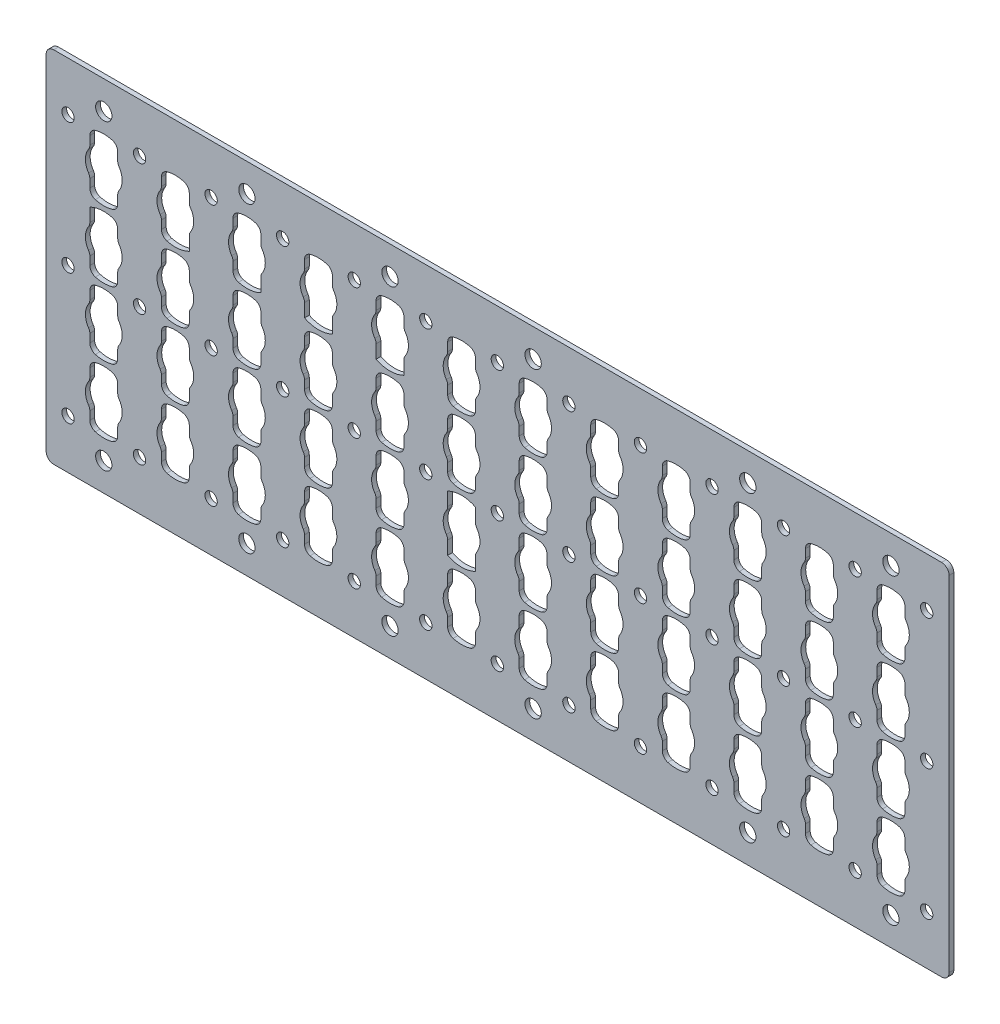
from build123d import *

# Parameters (mm, degrees)
SKETCH2_R           = 10.499946832
SKETCH2_R_2         = 2.752000084
BOSS_EXTRUDE1_DEPTH = 1.6
SKETCH7_R           = 1.2319
BOSS_EXTRUDE4_DEPTH = 1.6
FILLET1_R           = 2.54
SKETCH3_R           = 2.0828
CUT_EXTRUDE1_DEPTH  = 301.291907907
FILLET2_R           = 2.54


with BuildPart() as part:
    # Sketch2 → Boss-Extrude1 (new body)
    with BuildSketch(Plane.XY):
        Polygon((-19.430000002, 91.526), (-19.430000002, -23.708), (-19.430000002, -26.629), (285.048126016, -26.629), (285.048126016, -23.708), (285.048126016, 91.526), (285.048126016, 94.447), (-19.430000002, 94.447), align=None)
        Circle(SKETCH2_R, mode=Mode.SUBTRACT)
        with Locations((24.13, 0)):
            Circle(SKETCH2_R, mode=Mode.SUBTRACT)
        with Locations((48.26, 0)):
            Circle(SKETCH2_R, mode=Mode.SUBTRACT)
        with Locations((72.39, 0)):
            Circle(SKETCH2_R, mode=Mode.SUBTRACT)
        with Locations((24.13, 22.606)):
            Circle(SKETCH2_R, mode=Mode.SUBTRACT)
        with Locations((48.26, 22.606)):
            Circle(SKETCH2_R, mode=Mode.SUBTRACT)
        with Locations((72.39, 22.606)):
            Circle(SKETCH2_R, mode=Mode.SUBTRACT)
        with Locations((24.13, 45.212)):
            Circle(SKETCH2_R, mode=Mode.SUBTRACT)
        with Locations((48.26, 45.212)):
            Circle(SKETCH2_R, mode=Mode.SUBTRACT)
        with Locations((72.39, 45.212)):
            Circle(SKETCH2_R, mode=Mode.SUBTRACT)
        with Locations((24.13, 67.818)):
            Circle(SKETCH2_R, mode=Mode.SUBTRACT)
        with Locations((48.26, 67.818)):
            Circle(SKETCH2_R, mode=Mode.SUBTRACT)
        with Locations((72.39, 67.818)):
            Circle(SKETCH2_R, mode=Mode.SUBTRACT)
        with Locations((0, 22.606)):
            Circle(SKETCH2_R, mode=Mode.SUBTRACT)
        with Locations((0, 45.212)):
            Circle(SKETCH2_R, mode=Mode.SUBTRACT)
        with Locations((0, 67.818)):
            Circle(SKETCH2_R, mode=Mode.SUBTRACT)
        with Locations((96.52, 0)):
            Circle(SKETCH2_R, mode=Mode.SUBTRACT)
        with Locations((120.65, 0)):
            Circle(SKETCH2_R, mode=Mode.SUBTRACT)
        with Locations((144.78, 0)):
            Circle(SKETCH2_R, mode=Mode.SUBTRACT)
        with Locations((168.91, 0)):
            Circle(SKETCH2_R, mode=Mode.SUBTRACT)
        with Locations((193.04, 0)):
            Circle(SKETCH2_R, mode=Mode.SUBTRACT)
        with Locations((217.17, 0)):
            Circle(SKETCH2_R, mode=Mode.SUBTRACT)
        with Locations((241.3, 0)):
            Circle(SKETCH2_R, mode=Mode.SUBTRACT)
        with Locations((265.43, 0)):
            Circle(SKETCH2_R, mode=Mode.SUBTRACT)
        with Locations((96.52, 22.606)):
            Circle(SKETCH2_R, mode=Mode.SUBTRACT)
        with Locations((120.65, 22.606)):
            Circle(SKETCH2_R, mode=Mode.SUBTRACT)
        with Locations((144.78, 22.606)):
            Circle(SKETCH2_R, mode=Mode.SUBTRACT)
        with Locations((168.91, 22.606)):
            Circle(SKETCH2_R, mode=Mode.SUBTRACT)
        with Locations((193.04, 22.606)):
            Circle(SKETCH2_R, mode=Mode.SUBTRACT)
        with Locations((217.17, 22.606)):
            Circle(SKETCH2_R, mode=Mode.SUBTRACT)
        with Locations((241.3, 22.606)):
            Circle(SKETCH2_R, mode=Mode.SUBTRACT)
        with Locations((265.43, 22.606)):
            Circle(SKETCH2_R, mode=Mode.SUBTRACT)
        with Locations((96.52, 45.212)):
            Circle(SKETCH2_R, mode=Mode.SUBTRACT)
        with Locations((120.65, 45.212)):
            Circle(SKETCH2_R, mode=Mode.SUBTRACT)
        with Locations((144.78, 45.212)):
            Circle(SKETCH2_R, mode=Mode.SUBTRACT)
        with Locations((168.91, 45.212)):
            Circle(SKETCH2_R, mode=Mode.SUBTRACT)
        with Locations((193.04, 45.212)):
            Circle(SKETCH2_R, mode=Mode.SUBTRACT)
        with Locations((217.17, 45.212)):
            Circle(SKETCH2_R, mode=Mode.SUBTRACT)
        with Locations((241.3, 45.212)):
            Circle(SKETCH2_R, mode=Mode.SUBTRACT)
        with Locations((265.43, 45.212)):
            Circle(SKETCH2_R, mode=Mode.SUBTRACT)
        with Locations((96.52, 67.818)):
            Circle(SKETCH2_R, mode=Mode.SUBTRACT)
        with Locations((120.65, 67.818)):
            Circle(SKETCH2_R, mode=Mode.SUBTRACT)
        with Locations((144.78, 67.818)):
            Circle(SKETCH2_R, mode=Mode.SUBTRACT)
        with Locations((168.91, 67.818)):
            Circle(SKETCH2_R, mode=Mode.SUBTRACT)
        with Locations((193.04, 67.818)):
            Circle(SKETCH2_R, mode=Mode.SUBTRACT)
        with Locations((217.17, 67.818)):
            Circle(SKETCH2_R, mode=Mode.SUBTRACT)
        with Locations((241.3, 67.818)):
            Circle(SKETCH2_R, mode=Mode.SUBTRACT)
        with Locations((265.43, 67.818)):
            Circle(SKETCH2_R, mode=Mode.SUBTRACT)
        with Locations((0, 84.921973416)):
            Circle(SKETCH2_R_2, mode=Mode.SUBTRACT)
        with Locations((48.26, 84.921973416)):
            Circle(SKETCH2_R_2, mode=Mode.SUBTRACT)
        with Locations((96.52, 84.921973416)):
            Circle(SKETCH2_R_2, mode=Mode.SUBTRACT)
        with Locations((144.78, 84.921973416)):
            Circle(SKETCH2_R_2, mode=Mode.SUBTRACT)
        with Locations((217.17, 84.921973416)):
            Circle(SKETCH2_R_2, mode=Mode.SUBTRACT)
        with Locations((265.43, 84.921973416)):
            Circle(SKETCH2_R_2, mode=Mode.SUBTRACT)
        with Locations(Location((265.43, -17.103973416, 0), (0, 0, 180))):
            Circle(SKETCH2_R_2, mode=Mode.SUBTRACT)
        with Locations(Location((217.17, -17.103973416, 0), (0, 0, 180))):
            Circle(SKETCH2_R_2, mode=Mode.SUBTRACT)
        with Locations(Location((144.78, -17.103973416, 0), (0, 0, 180))):
            Circle(SKETCH2_R_2, mode=Mode.SUBTRACT)
        with Locations(Location((96.52, -17.103973416, 0), (0, 0, 180))):
            Circle(SKETCH2_R_2, mode=Mode.SUBTRACT)
        with Locations(Location((48.26, -17.103973416, 0), (0, 0, 180))):
            Circle(SKETCH2_R_2, mode=Mode.SUBTRACT)
        with Locations(Location((0, -17.103973416, 0), (0, 0, 180))):
            Circle(SKETCH2_R_2, mode=Mode.SUBTRACT)
    extrude(amount=BOSS_EXTRUDE1_DEPTH)

    # Sketch7 → Boss-Extrude4 (add, through all)
    # profile 1 of 13: a face of its own
    with BuildSketch(Plane.XY.offset(1.6)):
        with BuildLine():
            Line((19.430000002, 62.922315409), (19.430000002, 50.107684591))
            ThreePointArc((19.430000002, 50.107684591), (19.318582458, 49.363650145), (18.994104525, 48.684890102))
            ThreePointArc((18.994104525, 48.684890102), (17.930130002, 45.212), (18.994104525, 41.739109898))
            ThreePointArc((18.994104525, 41.739109898), (19.318582458, 41.060349855), (19.430000002, 40.316315409))
            Line((19.430000002, 40.316315409), (19.430000002, 27.501684591))
            ThreePointArc((19.430000002, 27.501684591), (19.318582458, 26.757650145), (18.994104525, 26.078890102))
            ThreePointArc((18.994104525, 26.078890102), (17.930130002, 22.606), (18.994104525, 19.133109898))
            ThreePointArc((18.994104525, 19.133109898), (19.318582458, 18.454349855), (19.430000002, 17.710315409))
            Line((19.430000002, 17.710315409), (19.430000002, 4.895684591))
            ThreePointArc((19.430000002, 4.895684591), (19.318582458, 4.151650145), (18.994104525, 3.472890102))
            ThreePointArc((18.994104525, 3.472890102), (17.930130002, 0), (18.994104525, -3.472890102))
            ThreePointArc((18.994104525, -3.472890102), (19.318582458, -4.151650145), (19.430000002, -4.895684591))
            Line((19.430000002, -4.895684591), (19.430000002, -10.5))
            Line((19.430000002, -10.5), (4.699999998, -10.5))
            Line((4.699999998, -10.5), (4.699999998, -4.895684591))
            ThreePointArc((4.699999998, -4.895684591), (4.811417542, -4.151650145), (5.135895475, -3.472890102))
            ThreePointArc((5.135895475, -3.472890102), (6.199869998, 0), (5.135895475, 3.472890102))
            ThreePointArc((5.135895475, 3.472890102), (4.811417542, 4.151650145), (4.699999998, 4.895684591))
            Line((4.699999998, 4.895684591), (4.699999998, 17.710315409))
            ThreePointArc((4.699999998, 17.710315409), (4.811417542, 18.454349855), (5.135895475, 19.133109898))
            ThreePointArc((5.135895475, 19.133109898), (6.199869998, 22.606), (5.135895475, 26.078890102))
            ThreePointArc((5.135895475, 26.078890102), (4.811417542, 26.757650145), (4.699999998, 27.501684591))
            Line((4.699999998, 27.501684591), (4.699999998, 40.316315409))
            ThreePointArc((4.699999998, 40.316315409), (4.811417542, 41.060349855), (5.135895475, 41.739109898))
            ThreePointArc((5.135895475, 41.739109898), (6.199869998, 45.212), (5.135895475, 48.684890102))
            ThreePointArc((5.135895475, 48.684890102), (4.811417542, 49.363650145), (4.699999998, 50.107684591))
            Line((4.699999998, 50.107684591), (4.699999998, 62.922315409))
            ThreePointArc((4.699999998, 62.922315409), (4.811417542, 63.666349855), (5.135895475, 64.345109898))
            ThreePointArc((5.135895475, 64.345109898), (6.199869998, 67.818), (5.135895475, 71.290890102))
            ThreePointArc((5.135895475, 71.290890102), (4.811417542, 71.969650145), (4.699999998, 72.713684591))
            Line((4.699999998, 72.713684591), (4.699999998, 78.318))
            Line((4.699999998, 78.318), (19.430000002, 78.318))
            Line((19.430000002, 78.318), (19.430000002, 72.713684591))
            ThreePointArc((19.430000002, 72.713684591), (19.318582458, 71.969650145), (18.994104525, 71.290890102))
            ThreePointArc((18.994104525, 71.290890102), (17.930130002, 67.818), (18.994104525, 64.345109898))
            ThreePointArc((18.994104525, 64.345109898), (19.318582458, 63.666349855), (19.430000002, 62.922315409))
        make_face()
        with Locations((12.065, 75.355240112)):
            Circle(SKETCH7_R, mode=Mode.SUBTRACT)
        with Locations((12.065, -7.537240112)):
            Circle(SKETCH7_R, mode=Mode.SUBTRACT)
    # profile 2 of 13: a face of its own
    with BuildSketch(Plane.XY.offset(1.6)):
        with BuildLine():
            Line((28.829999998, 17.710315409), (28.829999998, 4.895684591))
            ThreePointArc((28.829999998, 4.895684591), (28.941417542, 4.151650145), (29.265895475, 3.472890102))
            ThreePointArc((29.265895475, 3.472890102), (30.329869998, 0), (29.265895475, -3.472890102))
            ThreePointArc((29.265895475, -3.472890102), (28.941417542, -4.151650145), (28.829999998, -4.895684591))
            Line((28.829999998, -4.895684591), (28.829999998, -10.5))
            Line((28.829999998, -10.5), (43.560000002, -10.5))
            Line((43.560000002, -10.5), (43.560000002, -4.895684591))
            ThreePointArc((43.560000002, -4.895684591), (43.448582458, -4.151650145), (43.124104525, -3.472890102))
            ThreePointArc((43.124104525, -3.472890102), (42.060130002, 0), (43.124104525, 3.472890102))
            ThreePointArc((43.124104525, 3.472890102), (43.448582458, 4.151650145), (43.560000002, 4.895684591))
            Line((43.560000002, 4.895684591), (43.560000002, 17.710315409))
            ThreePointArc((43.560000002, 17.710315409), (43.448582458, 18.454349855), (43.124104525, 19.133109898))
            ThreePointArc((43.124104525, 19.133109898), (42.060130002, 22.606), (43.124104525, 26.078890102))
            ThreePointArc((43.124104525, 26.078890102), (43.448582458, 26.757650145), (43.560000002, 27.501684591))
            Line((43.560000002, 27.501684591), (43.560000002, 40.316315409))
            ThreePointArc((43.560000002, 40.316315409), (43.448582458, 41.060349855), (43.124104525, 41.739109898))
            ThreePointArc((43.124104525, 41.739109898), (42.060130002, 45.212), (43.124104525, 48.684890102))
            ThreePointArc((43.124104525, 48.684890102), (43.448582458, 49.363650145), (43.560000002, 50.107684591))
            Line((43.560000002, 50.107684591), (43.560000002, 62.922315409))
            ThreePointArc((43.560000002, 62.922315409), (43.448582458, 63.666349855), (43.124104525, 64.345109898))
            ThreePointArc((43.124104525, 64.345109898), (42.060130002, 67.818), (43.124104525, 71.290890102))
            ThreePointArc((43.124104525, 71.290890102), (43.448582458, 71.969650145), (43.560000002, 72.713684591))
            Line((43.560000002, 72.713684591), (43.560000002, 78.318))
            Line((43.560000002, 78.318), (28.829999998, 78.318))
            Line((28.829999998, 78.318), (28.829999998, 72.713684591))
            ThreePointArc((28.829999998, 72.713684591), (28.941417542, 71.969650145), (29.265895475, 71.290890102))
            ThreePointArc((29.265895475, 71.290890102), (30.329869998, 67.818), (29.265895475, 64.345109898))
            ThreePointArc((29.265895475, 64.345109898), (28.941417542, 63.666349855), (28.829999998, 62.922315409))
            Line((28.829999998, 62.922315409), (28.829999998, 50.107684591))
            ThreePointArc((28.829999998, 50.107684591), (28.941417542, 49.363650145), (29.265895475, 48.684890102))
            ThreePointArc((29.265895475, 48.684890102), (30.329869998, 45.212), (29.265895475, 41.739109898))
            ThreePointArc((29.265895475, 41.739109898), (28.941417542, 41.060349855), (28.829999998, 40.316315409))
            Line((28.829999998, 40.316315409), (28.829999998, 27.501684591))
            ThreePointArc((28.829999998, 27.501684591), (28.941417542, 26.757650145), (29.265895475, 26.078890102))
            ThreePointArc((29.265895475, 26.078890102), (30.329869998, 22.606), (29.265895475, 19.133109898))
            ThreePointArc((29.265895475, 19.133109898), (28.941417542, 18.454349855), (28.829999998, 17.710315409))
        make_face()
    # profile 3 of 13: a face of its own
    with BuildSketch(Plane.XY.offset(1.6)):
        with BuildLine():
            Line((52.959999998, 17.710315409), (52.959999998, 4.895684591))
            ThreePointArc((52.959999998, 4.895684591), (53.071417542, 4.151650145), (53.395895475, 3.472890102))
            ThreePointArc((53.395895475, 3.472890102), (54.459869998, 0), (53.395895475, -3.472890102))
            ThreePointArc((53.395895475, -3.472890102), (53.071417542, -4.151650145), (52.959999998, -4.895684591))
            Line((52.959999998, -4.895684591), (52.959999998, -10.5))
            Line((52.959999998, -10.5), (67.690000002, -10.5))
            Line((67.690000002, -10.5), (67.690000002, -4.895684591))
            ThreePointArc((67.690000002, -4.895684591), (67.578582458, -4.151650145), (67.254104525, -3.472890102))
            ThreePointArc((67.254104525, -3.472890102), (66.190130002, 0), (67.254104525, 3.472890102))
            ThreePointArc((67.254104525, 3.472890102), (67.578582458, 4.151650145), (67.690000002, 4.895684591))
            Line((67.690000002, 4.895684591), (67.690000002, 17.710315409))
            ThreePointArc((67.690000002, 17.710315409), (67.578582458, 18.454349855), (67.254104525, 19.133109898))
            ThreePointArc((67.254104525, 19.133109898), (66.190130002, 22.606), (67.254104525, 26.078890102))
            ThreePointArc((67.254104525, 26.078890102), (67.578582458, 26.757650145), (67.690000002, 27.501684591))
            Line((67.690000002, 27.501684591), (67.690000002, 40.316315409))
            ThreePointArc((67.690000002, 40.316315409), (67.578582458, 41.060349855), (67.254104525, 41.739109898))
            ThreePointArc((67.254104525, 41.739109898), (66.190130002, 45.212), (67.254104525, 48.684890102))
            ThreePointArc((67.254104525, 48.684890102), (67.578582458, 49.363650145), (67.690000002, 50.107684591))
            Line((67.690000002, 50.107684591), (67.690000002, 62.922315409))
            ThreePointArc((67.690000002, 62.922315409), (67.578582458, 63.666349855), (67.254104525, 64.345109898))
            ThreePointArc((67.254104525, 64.345109898), (66.190130002, 67.818), (67.254104525, 71.290890102))
            ThreePointArc((67.254104525, 71.290890102), (67.578582458, 71.969650145), (67.690000002, 72.713684591))
            Line((67.690000002, 72.713684591), (67.690000002, 78.318))
            Line((67.690000002, 78.318), (52.959999998, 78.318))
            Line((52.959999998, 78.318), (52.959999998, 72.713684591))
            ThreePointArc((52.959999998, 72.713684591), (53.071417542, 71.969650145), (53.395895475, 71.290890102))
            ThreePointArc((53.395895475, 71.290890102), (54.459869998, 67.818), (53.395895475, 64.345109898))
            ThreePointArc((53.395895475, 64.345109898), (53.071417542, 63.666349855), (52.959999998, 62.922315409))
            Line((52.959999998, 62.922315409), (52.959999998, 50.107684591))
            ThreePointArc((52.959999998, 50.107684591), (53.071417542, 49.363650145), (53.395895475, 48.684890102))
            ThreePointArc((53.395895475, 48.684890102), (54.459869998, 45.212), (53.395895475, 41.739109898))
            ThreePointArc((53.395895475, 41.739109898), (53.071417542, 41.060349855), (52.959999998, 40.316315409))
            Line((52.959999998, 40.316315409), (52.959999998, 27.501684591))
            ThreePointArc((52.959999998, 27.501684591), (53.071417542, 26.757650145), (53.395895475, 26.078890102))
            ThreePointArc((53.395895475, 26.078890102), (54.459869998, 22.606), (53.395895475, 19.133109898))
            ThreePointArc((53.395895475, 19.133109898), (53.071417542, 18.454349855), (52.959999998, 17.710315409))
        make_face()
    # profile 4 of 13: a face of its own
    with BuildSketch(Plane.XY.offset(1.6)):
        with BuildLine():
            Line((77.089999998, 17.710315409), (77.089999998, 4.895684591))
            ThreePointArc((77.089999998, 4.895684591), (77.201417542, 4.151650145), (77.525895475, 3.472890102))
            ThreePointArc((77.525895475, 3.472890102), (78.589869998, 0), (77.525895475, -3.472890102))
            ThreePointArc((77.525895475, -3.472890102), (77.201417542, -4.151650145), (77.089999998, -4.895684591))
            Line((77.089999998, -4.895684591), (77.089999998, -10.5))
            Line((77.089999998, -10.5), (91.820000002, -10.5))
            Line((91.820000002, -10.5), (91.820000002, -4.895684591))
            ThreePointArc((91.820000002, -4.895684591), (91.708582458, -4.151650145), (91.384104525, -3.472890102))
            ThreePointArc((91.384104525, -3.472890102), (90.320130002, 0), (91.384104525, 3.472890102))
            ThreePointArc((91.384104525, 3.472890102), (91.708582458, 4.151650145), (91.820000002, 4.895684591))
            Line((91.820000002, 4.895684591), (91.820000002, 17.710315409))
            ThreePointArc((91.820000002, 17.710315409), (91.708582458, 18.454349855), (91.384104525, 19.133109898))
            ThreePointArc((91.384104525, 19.133109898), (90.320130002, 22.606), (91.384104525, 26.078890102))
            ThreePointArc((91.384104525, 26.078890102), (91.708582458, 26.757650145), (91.820000002, 27.501684591))
            Line((91.820000002, 27.501684591), (91.820000002, 40.316315409))
            ThreePointArc((91.820000002, 40.316315409), (91.708582458, 41.060349855), (91.384104525, 41.739109898))
            ThreePointArc((91.384104525, 41.739109898), (90.320130002, 45.212), (91.384104525, 48.684890102))
            ThreePointArc((91.384104525, 48.684890102), (91.708582458, 49.363650145), (91.820000002, 50.107684591))
            Line((91.820000002, 50.107684591), (91.820000002, 62.922315409))
            ThreePointArc((91.820000002, 62.922315409), (91.708582458, 63.666349855), (91.384104525, 64.345109898))
            ThreePointArc((91.384104525, 64.345109898), (90.320130002, 67.818), (91.384104525, 71.290890102))
            ThreePointArc((91.384104525, 71.290890102), (91.708582458, 71.969650145), (91.820000002, 72.713684591))
            Line((91.820000002, 72.713684591), (91.820000002, 78.318))
            Line((91.820000002, 78.318), (77.089999998, 78.318))
            Line((77.089999998, 78.318), (77.089999998, 72.713684591))
            ThreePointArc((77.089999998, 72.713684591), (77.201417542, 71.969650145), (77.525895475, 71.290890102))
            ThreePointArc((77.525895475, 71.290890102), (78.589869998, 67.818), (77.525895475, 64.345109898))
            ThreePointArc((77.525895475, 64.345109898), (77.201417542, 63.666349855), (77.089999998, 62.922315409))
            Line((77.089999998, 62.922315409), (77.089999998, 50.107684591))
            ThreePointArc((77.089999998, 50.107684591), (77.201417542, 49.363650145), (77.525895475, 48.684890102))
            ThreePointArc((77.525895475, 48.684890102), (78.589869998, 45.212), (77.525895475, 41.739109898))
            ThreePointArc((77.525895475, 41.739109898), (77.201417542, 41.060349855), (77.089999998, 40.316315409))
            Line((77.089999998, 40.316315409), (77.089999998, 27.501684591))
            ThreePointArc((77.089999998, 27.501684591), (77.201417542, 26.757650145), (77.525895475, 26.078890102))
            ThreePointArc((77.525895475, 26.078890102), (78.589869998, 22.606), (77.525895475, 19.133109898))
            ThreePointArc((77.525895475, 19.133109898), (77.201417542, 18.454349855), (77.089999998, 17.710315409))
        make_face()
    # profile 5 of 13: a face of its own
    with BuildSketch(Plane.XY.offset(1.6)):
        with BuildLine():
            Line((101.219999998, 17.710315409), (101.219999998, 4.895684591))
            ThreePointArc((101.219999998, 4.895684591), (101.331417542, 4.151650145), (101.655895475, 3.472890102))
            ThreePointArc((101.655895475, 3.472890102), (102.719869998, 0), (101.655895475, -3.472890102))
            ThreePointArc((101.655895475, -3.472890102), (101.331417542, -4.151650145), (101.219999998, -4.895684591))
            Line((101.219999998, -4.895684591), (101.219999998, -10.5))
            Line((101.219999998, -10.5), (115.950000002, -10.5))
            Line((115.950000002, -10.5), (115.950000002, -4.895684591))
            ThreePointArc((115.950000002, -4.895684591), (115.838582458, -4.151650145), (115.514104525, -3.472890102))
            ThreePointArc((115.514104525, -3.472890102), (114.450130002, 0), (115.514104525, 3.472890102))
            ThreePointArc((115.514104525, 3.472890102), (115.838582458, 4.151650145), (115.950000002, 4.895684591))
            Line((115.950000002, 4.895684591), (115.950000002, 17.710315409))
            ThreePointArc((115.950000002, 17.710315409), (115.838582458, 18.454349855), (115.514104525, 19.133109898))
            ThreePointArc((115.514104525, 19.133109898), (114.450130002, 22.606), (115.514104525, 26.078890102))
            ThreePointArc((115.514104525, 26.078890102), (115.838582458, 26.757650145), (115.950000002, 27.501684591))
            Line((115.950000002, 27.501684591), (115.950000002, 40.316315409))
            ThreePointArc((115.950000002, 40.316315409), (115.838582458, 41.060349855), (115.514104525, 41.739109898))
            ThreePointArc((115.514104525, 41.739109898), (114.450130002, 45.212), (115.514104525, 48.684890102))
            ThreePointArc((115.514104525, 48.684890102), (115.838582458, 49.363650145), (115.950000002, 50.107684591))
            Line((115.950000002, 50.107684591), (115.950000002, 62.922315409))
            ThreePointArc((115.950000002, 62.922315409), (115.838582458, 63.666349855), (115.514104525, 64.345109898))
            ThreePointArc((115.514104525, 64.345109898), (114.450130002, 67.818), (115.514104525, 71.290890102))
            ThreePointArc((115.514104525, 71.290890102), (115.838582458, 71.969650145), (115.950000002, 72.713684591))
            Line((115.950000002, 72.713684591), (115.950000002, 78.318))
            Line((115.950000002, 78.318), (101.219999998, 78.318))
            Line((101.219999998, 78.318), (101.219999998, 72.713684591))
            ThreePointArc((101.219999998, 72.713684591), (101.331417542, 71.969650145), (101.655895475, 71.290890102))
            ThreePointArc((101.655895475, 71.290890102), (102.719869998, 67.818), (101.655895475, 64.345109898))
            ThreePointArc((101.655895475, 64.345109898), (101.331417542, 63.666349855), (101.219999998, 62.922315409))
            Line((101.219999998, 62.922315409), (101.219999998, 50.107684591))
            ThreePointArc((101.219999998, 50.107684591), (101.331417542, 49.363650145), (101.655895475, 48.684890102))
            ThreePointArc((101.655895475, 48.684890102), (102.719869998, 45.212), (101.655895475, 41.739109898))
            ThreePointArc((101.655895475, 41.739109898), (101.331417542, 41.060349855), (101.219999998, 40.316315409))
            Line((101.219999998, 40.316315409), (101.219999998, 27.501684591))
            ThreePointArc((101.219999998, 27.501684591), (101.331417542, 26.757650145), (101.655895475, 26.078890102))
            ThreePointArc((101.655895475, 26.078890102), (102.719869998, 22.606), (101.655895475, 19.133109898))
            ThreePointArc((101.655895475, 19.133109898), (101.331417542, 18.454349855), (101.219999998, 17.710315409))
        make_face()
    # profile 6 of 13: a face of its own
    with BuildSketch(Plane.XY.offset(1.6)):
        with BuildLine():
            Line((125.349999998, 17.710315409), (125.349999998, 4.895684591))
            ThreePointArc((125.349999998, 4.895684591), (125.461417542, 4.151650145), (125.785895475, 3.472890102))
            ThreePointArc((125.785895475, 3.472890102), (126.849869998, 0), (125.785895475, -3.472890102))
            ThreePointArc((125.785895475, -3.472890102), (125.461417542, -4.151650145), (125.349999998, -4.895684591))
            Line((125.349999998, -4.895684591), (125.349999998, -10.5))
            Line((125.349999998, -10.5), (140.080000002, -10.5))
            Line((140.080000002, -10.5), (140.080000002, -4.895684591))
            ThreePointArc((140.080000002, -4.895684591), (139.968582458, -4.151650145), (139.644104525, -3.472890102))
            ThreePointArc((139.644104525, -3.472890102), (138.580130002, 0), (139.644104525, 3.472890102))
            ThreePointArc((139.644104525, 3.472890102), (139.968582458, 4.151650145), (140.080000002, 4.895684591))
            Line((140.080000002, 4.895684591), (140.080000002, 17.710315409))
            ThreePointArc((140.080000002, 17.710315409), (139.968582458, 18.454349855), (139.644104525, 19.133109898))
            ThreePointArc((139.644104525, 19.133109898), (138.580130002, 22.606), (139.644104525, 26.078890102))
            ThreePointArc((139.644104525, 26.078890102), (139.968582458, 26.757650145), (140.080000002, 27.501684591))
            Line((140.080000002, 27.501684591), (140.080000002, 40.316315409))
            ThreePointArc((140.080000002, 40.316315409), (139.968582458, 41.060349855), (139.644104525, 41.739109898))
            ThreePointArc((139.644104525, 41.739109898), (138.580130002, 45.212), (139.644104525, 48.684890102))
            ThreePointArc((139.644104525, 48.684890102), (139.968582458, 49.363650145), (140.080000002, 50.107684591))
            Line((140.080000002, 50.107684591), (140.080000002, 62.922315409))
            ThreePointArc((140.080000002, 62.922315409), (139.968582458, 63.666349855), (139.644104525, 64.345109898))
            ThreePointArc((139.644104525, 64.345109898), (138.580130002, 67.818), (139.644104525, 71.290890102))
            ThreePointArc((139.644104525, 71.290890102), (139.968582458, 71.969650145), (140.080000002, 72.713684591))
            Line((140.080000002, 72.713684591), (140.080000002, 78.318))
            Line((140.080000002, 78.318), (125.349999998, 78.318))
            Line((125.349999998, 78.318), (125.349999998, 72.713684591))
            ThreePointArc((125.349999998, 72.713684591), (125.461417542, 71.969650145), (125.785895475, 71.290890102))
            ThreePointArc((125.785895475, 71.290890102), (126.849869998, 67.818), (125.785895475, 64.345109898))
            ThreePointArc((125.785895475, 64.345109898), (125.461417542, 63.666349855), (125.349999998, 62.922315409))
            Line((125.349999998, 62.922315409), (125.349999998, 50.107684591))
            ThreePointArc((125.349999998, 50.107684591), (125.461417542, 49.363650145), (125.785895475, 48.684890102))
            ThreePointArc((125.785895475, 48.684890102), (126.849869998, 45.212), (125.785895475, 41.739109898))
            ThreePointArc((125.785895475, 41.739109898), (125.461417542, 41.060349855), (125.349999998, 40.316315409))
            Line((125.349999998, 40.316315409), (125.349999998, 27.501684591))
            ThreePointArc((125.349999998, 27.501684591), (125.461417542, 26.757650145), (125.785895475, 26.078890102))
            ThreePointArc((125.785895475, 26.078890102), (126.849869998, 22.606), (125.785895475, 19.133109898))
            ThreePointArc((125.785895475, 19.133109898), (125.461417542, 18.454349855), (125.349999998, 17.710315409))
        make_face()
    # profile 7 of 13: a face of its own
    with BuildSketch(Plane.XY.offset(1.6)):
        with BuildLine():
            Line((149.479999998, 17.710315409), (149.479999998, 4.895684591))
            ThreePointArc((149.479999998, 4.895684591), (149.591417542, 4.151650145), (149.915895475, 3.472890102))
            ThreePointArc((149.915895475, 3.472890102), (150.979869998, 0), (149.915895475, -3.472890102))
            ThreePointArc((149.915895475, -3.472890102), (149.591417542, -4.151650145), (149.479999998, -4.895684591))
            Line((149.479999998, -4.895684591), (149.479999998, -10.5))
            Line((149.479999998, -10.5), (164.210000002, -10.5))
            Line((164.210000002, -10.5), (164.210000002, -4.895684591))
            ThreePointArc((164.210000002, -4.895684591), (164.098582458, -4.151650145), (163.774104525, -3.472890102))
            ThreePointArc((163.774104525, -3.472890102), (162.710130002, 0), (163.774104525, 3.472890102))
            ThreePointArc((163.774104525, 3.472890102), (164.098582458, 4.151650145), (164.210000002, 4.895684591))
            Line((164.210000002, 4.895684591), (164.210000002, 17.710315409))
            ThreePointArc((164.210000002, 17.710315409), (164.098582458, 18.454349855), (163.774104525, 19.133109898))
            ThreePointArc((163.774104525, 19.133109898), (162.710130002, 22.606), (163.774104525, 26.078890102))
            ThreePointArc((163.774104525, 26.078890102), (164.098582458, 26.757650145), (164.210000002, 27.501684591))
            Line((164.210000002, 27.501684591), (164.210000002, 40.316315409))
            ThreePointArc((164.210000002, 40.316315409), (164.098582458, 41.060349855), (163.774104525, 41.739109898))
            ThreePointArc((163.774104525, 41.739109898), (162.710130002, 45.212), (163.774104525, 48.684890102))
            ThreePointArc((163.774104525, 48.684890102), (164.098582458, 49.363650145), (164.210000002, 50.107684591))
            Line((164.210000002, 50.107684591), (164.210000002, 62.922315409))
            ThreePointArc((164.210000002, 62.922315409), (164.098582458, 63.666349855), (163.774104525, 64.345109898))
            ThreePointArc((163.774104525, 64.345109898), (162.710130002, 67.818), (163.774104525, 71.290890102))
            ThreePointArc((163.774104525, 71.290890102), (164.098582458, 71.969650145), (164.210000002, 72.713684591))
            Line((164.210000002, 72.713684591), (164.210000002, 78.318))
            Line((164.210000002, 78.318), (149.479999998, 78.318))
            Line((149.479999998, 78.318), (149.479999998, 72.713684591))
            ThreePointArc((149.479999998, 72.713684591), (149.591417542, 71.969650145), (149.915895475, 71.290890102))
            ThreePointArc((149.915895475, 71.290890102), (150.979869998, 67.818), (149.915895475, 64.345109898))
            ThreePointArc((149.915895475, 64.345109898), (149.591417542, 63.666349855), (149.479999998, 62.922315409))
            Line((149.479999998, 62.922315409), (149.479999998, 50.107684591))
            ThreePointArc((149.479999998, 50.107684591), (149.591417542, 49.363650145), (149.915895475, 48.684890102))
            ThreePointArc((149.915895475, 48.684890102), (150.979869998, 45.212), (149.915895475, 41.739109898))
            ThreePointArc((149.915895475, 41.739109898), (149.591417542, 41.060349855), (149.479999998, 40.316315409))
            Line((149.479999998, 40.316315409), (149.479999998, 27.501684591))
            ThreePointArc((149.479999998, 27.501684591), (149.591417542, 26.757650145), (149.915895475, 26.078890102))
            ThreePointArc((149.915895475, 26.078890102), (150.979869998, 22.606), (149.915895475, 19.133109898))
            ThreePointArc((149.915895475, 19.133109898), (149.591417542, 18.454349855), (149.479999998, 17.710315409))
        make_face()
    # profile 8 of 13: a face of its own
    with BuildSketch(Plane.XY.offset(1.6)):
        with BuildLine():
            Line((173.609999998, 17.710315409), (173.609999998, 4.895684591))
            ThreePointArc((173.609999998, 4.895684591), (173.721417542, 4.151650145), (174.045895475, 3.472890102))
            ThreePointArc((174.045895475, 3.472890102), (175.109869998, 0), (174.045895475, -3.472890102))
            ThreePointArc((174.045895475, -3.472890102), (173.721417542, -4.151650145), (173.609999998, -4.895684591))
            Line((173.609999998, -4.895684591), (173.609999998, -10.5))
            Line((173.609999998, -10.5), (188.340000002, -10.5))
            Line((188.340000002, -10.5), (188.340000002, -4.895684591))
            ThreePointArc((188.340000002, -4.895684591), (188.228582458, -4.151650145), (187.904104525, -3.472890102))
            ThreePointArc((187.904104525, -3.472890102), (186.840130002, 0), (187.904104525, 3.472890102))
            ThreePointArc((187.904104525, 3.472890102), (188.228582458, 4.151650145), (188.340000002, 4.895684591))
            Line((188.340000002, 4.895684591), (188.340000002, 17.710315409))
            ThreePointArc((188.340000002, 17.710315409), (188.228582458, 18.454349855), (187.904104525, 19.133109898))
            ThreePointArc((187.904104525, 19.133109898), (186.840130002, 22.606), (187.904104525, 26.078890102))
            ThreePointArc((187.904104525, 26.078890102), (188.228582458, 26.757650145), (188.340000002, 27.501684591))
            Line((188.340000002, 27.501684591), (188.340000002, 40.316315409))
            ThreePointArc((188.340000002, 40.316315409), (188.228582458, 41.060349855), (187.904104525, 41.739109898))
            ThreePointArc((187.904104525, 41.739109898), (186.840130002, 45.212), (187.904104525, 48.684890102))
            ThreePointArc((187.904104525, 48.684890102), (188.228582458, 49.363650145), (188.340000002, 50.107684591))
            Line((188.340000002, 50.107684591), (188.340000002, 62.922315409))
            ThreePointArc((188.340000002, 62.922315409), (188.228582458, 63.666349855), (187.904104525, 64.345109898))
            ThreePointArc((187.904104525, 64.345109898), (186.840130002, 67.818), (187.904104525, 71.290890102))
            ThreePointArc((187.904104525, 71.290890102), (188.228582458, 71.969650145), (188.340000002, 72.713684591))
            Line((188.340000002, 72.713684591), (188.340000002, 78.318))
            Line((188.340000002, 78.318), (173.609999998, 78.318))
            Line((173.609999998, 78.318), (173.609999998, 72.713684591))
            ThreePointArc((173.609999998, 72.713684591), (173.721417542, 71.969650145), (174.045895475, 71.290890102))
            ThreePointArc((174.045895475, 71.290890102), (175.109869998, 67.818), (174.045895475, 64.345109898))
            ThreePointArc((174.045895475, 64.345109898), (173.721417542, 63.666349855), (173.609999998, 62.922315409))
            Line((173.609999998, 62.922315409), (173.609999998, 50.107684591))
            ThreePointArc((173.609999998, 50.107684591), (173.721417542, 49.363650145), (174.045895475, 48.684890102))
            ThreePointArc((174.045895475, 48.684890102), (175.109869998, 45.212), (174.045895475, 41.739109898))
            ThreePointArc((174.045895475, 41.739109898), (173.721417542, 41.060349855), (173.609999998, 40.316315409))
            Line((173.609999998, 40.316315409), (173.609999998, 27.501684591))
            ThreePointArc((173.609999998, 27.501684591), (173.721417542, 26.757650145), (174.045895475, 26.078890102))
            ThreePointArc((174.045895475, 26.078890102), (175.109869998, 22.606), (174.045895475, 19.133109898))
            ThreePointArc((174.045895475, 19.133109898), (173.721417542, 18.454349855), (173.609999998, 17.710315409))
        make_face()
    # profile 9 of 13: a face of its own
    with BuildSketch(Plane.XY.offset(1.6)):
        with BuildLine():
            Line((197.739999998, 17.710315409), (197.739999998, 4.895684591))
            ThreePointArc((197.739999998, 4.895684591), (197.851417542, 4.151650145), (198.175895475, 3.472890102))
            ThreePointArc((198.175895475, 3.472890102), (199.239869998, 0), (198.175895475, -3.472890102))
            ThreePointArc((198.175895475, -3.472890102), (197.851417542, -4.151650145), (197.739999998, -4.895684591))
            Line((197.739999998, -4.895684591), (197.739999998, -10.5))
            Line((197.739999998, -10.5), (212.470000002, -10.5))
            Line((212.470000002, -10.5), (212.470000002, -4.895684591))
            ThreePointArc((212.470000002, -4.895684591), (212.358582458, -4.151650145), (212.034104525, -3.472890102))
            ThreePointArc((212.034104525, -3.472890102), (210.970130002, 0), (212.034104525, 3.472890102))
            ThreePointArc((212.034104525, 3.472890102), (212.358582458, 4.151650145), (212.470000002, 4.895684591))
            Line((212.470000002, 4.895684591), (212.470000002, 17.710315409))
            ThreePointArc((212.470000002, 17.710315409), (212.358582458, 18.454349855), (212.034104525, 19.133109898))
            ThreePointArc((212.034104525, 19.133109898), (210.970130002, 22.606), (212.034104525, 26.078890102))
            ThreePointArc((212.034104525, 26.078890102), (212.358582458, 26.757650145), (212.470000002, 27.501684591))
            Line((212.470000002, 27.501684591), (212.470000002, 40.316315409))
            ThreePointArc((212.470000002, 40.316315409), (212.358582458, 41.060349855), (212.034104525, 41.739109898))
            ThreePointArc((212.034104525, 41.739109898), (210.970130002, 45.212), (212.034104525, 48.684890102))
            ThreePointArc((212.034104525, 48.684890102), (212.358582458, 49.363650145), (212.470000002, 50.107684591))
            Line((212.470000002, 50.107684591), (212.470000002, 62.922315409))
            ThreePointArc((212.470000002, 62.922315409), (212.358582458, 63.666349855), (212.034104525, 64.345109898))
            ThreePointArc((212.034104525, 64.345109898), (210.970130002, 67.818), (212.034104525, 71.290890102))
            ThreePointArc((212.034104525, 71.290890102), (212.358582458, 71.969650145), (212.470000002, 72.713684591))
            Line((212.470000002, 72.713684591), (212.470000002, 78.318))
            Line((212.470000002, 78.318), (197.739999998, 78.318))
            Line((197.739999998, 78.318), (197.739999998, 72.713684591))
            ThreePointArc((197.739999998, 72.713684591), (197.851417542, 71.969650145), (198.175895475, 71.290890102))
            ThreePointArc((198.175895475, 71.290890102), (199.239869998, 67.818), (198.175895475, 64.345109898))
            ThreePointArc((198.175895475, 64.345109898), (197.851417542, 63.666349855), (197.739999998, 62.922315409))
            Line((197.739999998, 62.922315409), (197.739999998, 50.107684591))
            ThreePointArc((197.739999998, 50.107684591), (197.851417542, 49.363650145), (198.175895475, 48.684890102))
            ThreePointArc((198.175895475, 48.684890102), (199.239869998, 45.212), (198.175895475, 41.739109898))
            ThreePointArc((198.175895475, 41.739109898), (197.851417542, 41.060349855), (197.739999998, 40.316315409))
            Line((197.739999998, 40.316315409), (197.739999998, 27.501684591))
            ThreePointArc((197.739999998, 27.501684591), (197.851417542, 26.757650145), (198.175895475, 26.078890102))
            ThreePointArc((198.175895475, 26.078890102), (199.239869998, 22.606), (198.175895475, 19.133109898))
            ThreePointArc((198.175895475, 19.133109898), (197.851417542, 18.454349855), (197.739999998, 17.710315409))
        make_face()
    # profile 10 of 13: a face of its own
    with BuildSketch(Plane.XY.offset(1.6)):
        with BuildLine():
            Line((221.869999998, 17.710315409), (221.869999998, 4.895684591))
            ThreePointArc((221.869999998, 4.895684591), (221.981417542, 4.151650145), (222.305895475, 3.472890102))
            ThreePointArc((222.305895475, 3.472890102), (223.369869998, 0), (222.305895475, -3.472890102))
            ThreePointArc((222.305895475, -3.472890102), (221.981417542, -4.151650145), (221.869999998, -4.895684591))
            Line((221.869999998, -4.895684591), (221.869999998, -10.5))
            Line((221.869999998, -10.5), (236.600000002, -10.5))
            Line((236.600000002, -10.5), (236.600000002, -4.895684591))
            ThreePointArc((236.600000002, -4.895684591), (236.488582458, -4.151650145), (236.164104525, -3.472890102))
            ThreePointArc((236.164104525, -3.472890102), (235.100130002, 0), (236.164104525, 3.472890102))
            ThreePointArc((236.164104525, 3.472890102), (236.488582458, 4.151650145), (236.600000002, 4.895684591))
            Line((236.600000002, 4.895684591), (236.600000002, 17.710315409))
            ThreePointArc((236.600000002, 17.710315409), (236.488582458, 18.454349855), (236.164104525, 19.133109898))
            ThreePointArc((236.164104525, 19.133109898), (235.100130002, 22.606), (236.164104525, 26.078890102))
            ThreePointArc((236.164104525, 26.078890102), (236.488582458, 26.757650145), (236.600000002, 27.501684591))
            Line((236.600000002, 27.501684591), (236.600000002, 40.316315409))
            ThreePointArc((236.600000002, 40.316315409), (236.488582458, 41.060349855), (236.164104525, 41.739109898))
            ThreePointArc((236.164104525, 41.739109898), (235.100130002, 45.212), (236.164104525, 48.684890102))
            ThreePointArc((236.164104525, 48.684890102), (236.488582458, 49.363650145), (236.600000002, 50.107684591))
            Line((236.600000002, 50.107684591), (236.600000002, 62.922315409))
            ThreePointArc((236.600000002, 62.922315409), (236.488582458, 63.666349855), (236.164104525, 64.345109898))
            ThreePointArc((236.164104525, 64.345109898), (235.100130002, 67.818), (236.164104525, 71.290890102))
            ThreePointArc((236.164104525, 71.290890102), (236.488582458, 71.969650145), (236.600000002, 72.713684591))
            Line((236.600000002, 72.713684591), (236.600000002, 78.318))
            Line((236.600000002, 78.318), (221.869999998, 78.318))
            Line((221.869999998, 78.318), (221.869999998, 72.713684591))
            ThreePointArc((221.869999998, 72.713684591), (221.981417542, 71.969650145), (222.305895475, 71.290890102))
            ThreePointArc((222.305895475, 71.290890102), (223.369869998, 67.818), (222.305895475, 64.345109898))
            ThreePointArc((222.305895475, 64.345109898), (221.981417542, 63.666349855), (221.869999998, 62.922315409))
            Line((221.869999998, 62.922315409), (221.869999998, 50.107684591))
            ThreePointArc((221.869999998, 50.107684591), (221.981417542, 49.363650145), (222.305895475, 48.684890102))
            ThreePointArc((222.305895475, 48.684890102), (223.369869998, 45.212), (222.305895475, 41.739109898))
            ThreePointArc((222.305895475, 41.739109898), (221.981417542, 41.060349855), (221.869999998, 40.316315409))
            Line((221.869999998, 40.316315409), (221.869999998, 27.501684591))
            ThreePointArc((221.869999998, 27.501684591), (221.981417542, 26.757650145), (222.305895475, 26.078890102))
            ThreePointArc((222.305895475, 26.078890102), (223.369869998, 22.606), (222.305895475, 19.133109898))
            ThreePointArc((222.305895475, 19.133109898), (221.981417542, 18.454349855), (221.869999998, 17.710315409))
        make_face()
    # profile 11 of 13: a face of its own
    with BuildSketch(Plane.XY.offset(1.6)):
        with BuildLine():
            Line((245.999999998, 17.710315409), (245.999999998, 4.895684591))
            ThreePointArc((245.999999998, 4.895684591), (246.111417542, 4.151650145), (246.435895475, 3.472890102))
            ThreePointArc((246.435895475, 3.472890102), (247.499869998, 0), (246.435895475, -3.472890102))
            ThreePointArc((246.435895475, -3.472890102), (246.111417542, -4.151650145), (245.999999998, -4.895684591))
            Line((245.999999998, -4.895684591), (245.999999998, -10.5))
            Line((245.999999998, -10.5), (260.730000002, -10.5))
            Line((260.730000002, -10.5), (260.730000002, -4.895684591))
            ThreePointArc((260.730000002, -4.895684591), (260.618582458, -4.151650145), (260.294104525, -3.472890102))
            ThreePointArc((260.294104525, -3.472890102), (259.230130002, 0), (260.294104525, 3.472890102))
            ThreePointArc((260.294104525, 3.472890102), (260.618582458, 4.151650145), (260.730000002, 4.895684591))
            Line((260.730000002, 4.895684591), (260.730000002, 17.710315409))
            ThreePointArc((260.730000002, 17.710315409), (260.618582458, 18.454349855), (260.294104525, 19.133109898))
            ThreePointArc((260.294104525, 19.133109898), (259.230130002, 22.606), (260.294104525, 26.078890102))
            ThreePointArc((260.294104525, 26.078890102), (260.618582458, 26.757650145), (260.730000002, 27.501684591))
            Line((260.730000002, 27.501684591), (260.730000002, 40.316315409))
            ThreePointArc((260.730000002, 40.316315409), (260.618582458, 41.060349855), (260.294104525, 41.739109898))
            ThreePointArc((260.294104525, 41.739109898), (259.230130002, 45.212), (260.294104525, 48.684890102))
            ThreePointArc((260.294104525, 48.684890102), (260.618582458, 49.363650145), (260.730000002, 50.107684591))
            Line((260.730000002, 50.107684591), (260.730000002, 62.922315409))
            ThreePointArc((260.730000002, 62.922315409), (260.618582458, 63.666349855), (260.294104525, 64.345109898))
            ThreePointArc((260.294104525, 64.345109898), (259.230130002, 67.818), (260.294104525, 71.290890102))
            ThreePointArc((260.294104525, 71.290890102), (260.618582458, 71.969650145), (260.730000002, 72.713684591))
            Line((260.730000002, 72.713684591), (260.730000002, 78.318))
            Line((260.730000002, 78.318), (245.999999998, 78.318))
            Line((245.999999998, 78.318), (245.999999998, 72.713684591))
            ThreePointArc((245.999999998, 72.713684591), (246.111417542, 71.969650145), (246.435895475, 71.290890102))
            ThreePointArc((246.435895475, 71.290890102), (247.499869998, 67.818), (246.435895475, 64.345109898))
            ThreePointArc((246.435895475, 64.345109898), (246.111417542, 63.666349855), (245.999999998, 62.922315409))
            Line((245.999999998, 62.922315409), (245.999999998, 50.107684591))
            ThreePointArc((245.999999998, 50.107684591), (246.111417542, 49.363650145), (246.435895475, 48.684890102))
            ThreePointArc((246.435895475, 48.684890102), (247.499869998, 45.212), (246.435895475, 41.739109898))
            ThreePointArc((246.435895475, 41.739109898), (246.111417542, 41.060349855), (245.999999998, 40.316315409))
            Line((245.999999998, 40.316315409), (245.999999998, 27.501684591))
            ThreePointArc((245.999999998, 27.501684591), (246.111417542, 26.757650145), (246.435895475, 26.078890102))
            ThreePointArc((246.435895475, 26.078890102), (247.499869998, 22.606), (246.435895475, 19.133109898))
            ThreePointArc((246.435895475, 19.133109898), (246.111417542, 18.454349855), (245.999999998, 17.710315409))
        make_face()
    # profile 12 of 13: a face of its own
    with BuildSketch(Plane.XY.offset(1.6)):
        with BuildLine():
            Line((270.129999998, 17.710315409), (270.129999998, 4.895684591))
            ThreePointArc((270.129999998, 4.895684591), (270.241417542, 4.151650145), (270.565895475, 3.472890102))
            ThreePointArc((270.565895475, 3.472890102), (271.629869998, 0), (270.565895475, -3.472890102))
            ThreePointArc((270.565895475, -3.472890102), (270.241417542, -4.151650145), (270.129999998, -4.895684591))
            Line((270.129999998, -4.895684591), (270.129999998, -10.5))
            Line((270.129999998, -10.5), (284.860000002, -10.5))
            Line((284.860000002, -10.5), (284.860000002, -4.895684591))
            ThreePointArc((284.860000002, -4.895684591), (284.748582458, -4.151650145), (284.424104525, -3.472890102))
            ThreePointArc((284.424104525, -3.472890102), (283.360130002, 0), (284.424104525, 3.472890102))
            ThreePointArc((284.424104525, 3.472890102), (284.748582458, 4.151650145), (284.860000002, 4.895684591))
            Line((284.860000002, 4.895684591), (284.860000002, 17.710315409))
            ThreePointArc((284.860000002, 17.710315409), (284.748582458, 18.454349855), (284.424104525, 19.133109898))
            ThreePointArc((284.424104525, 19.133109898), (283.360130002, 22.606), (284.424104525, 26.078890102))
            ThreePointArc((284.424104525, 26.078890102), (284.748582458, 26.757650145), (284.860000002, 27.501684591))
            Line((284.860000002, 27.501684591), (284.860000002, 40.316315409))
            ThreePointArc((284.860000002, 40.316315409), (284.748582458, 41.060349855), (284.424104525, 41.739109898))
            ThreePointArc((284.424104525, 41.739109898), (283.360130002, 45.212), (284.424104525, 48.684890102))
            ThreePointArc((284.424104525, 48.684890102), (284.748582458, 49.363650145), (284.860000002, 50.107684591))
            Line((284.860000002, 50.107684591), (284.860000002, 62.922315409))
            ThreePointArc((284.860000002, 62.922315409), (284.748582458, 63.666349855), (284.424104525, 64.345109898))
            ThreePointArc((284.424104525, 64.345109898), (283.360130002, 67.818), (284.424104525, 71.290890102))
            ThreePointArc((284.424104525, 71.290890102), (284.748582458, 71.969650145), (284.860000002, 72.713684591))
            Line((284.860000002, 72.713684591), (284.860000002, 78.318))
            Line((284.860000002, 78.318), (270.129999998, 78.318))
            Line((270.129999998, 78.318), (270.129999998, 72.713684591))
            ThreePointArc((270.129999998, 72.713684591), (270.241417542, 71.969650145), (270.565895475, 71.290890102))
            ThreePointArc((270.565895475, 71.290890102), (271.629869998, 67.818), (270.565895475, 64.345109898))
            ThreePointArc((270.565895475, 64.345109898), (270.241417542, 63.666349855), (270.129999998, 62.922315409))
            Line((270.129999998, 62.922315409), (270.129999998, 50.107684591))
            ThreePointArc((270.129999998, 50.107684591), (270.241417542, 49.363650145), (270.565895475, 48.684890102))
            ThreePointArc((270.565895475, 48.684890102), (271.629869998, 45.212), (270.565895475, 41.739109898))
            ThreePointArc((270.565895475, 41.739109898), (270.241417542, 41.060349855), (270.129999998, 40.316315409))
            Line((270.129999998, 40.316315409), (270.129999998, 27.501684591))
            ThreePointArc((270.129999998, 27.501684591), (270.241417542, 26.757650145), (270.565895475, 26.078890102))
            ThreePointArc((270.565895475, 26.078890102), (271.629869998, 22.606), (270.565895475, 19.133109898))
            ThreePointArc((270.565895475, 19.133109898), (270.241417542, 18.454349855), (270.129999998, 17.710315409))
        make_face()
    # profile 13 of 13: a face of its own
    with BuildSketch(Plane.XY.offset(1.6)):
        with BuildLine():
            Line((-19.430000002, 17.710315409), (-19.430000002, 4.895684591))
            ThreePointArc((-19.430000002, 4.895684591), (-19.318582458, 4.151650145), (-18.994104525, 3.472890102))
            ThreePointArc((-18.994104525, 3.472890102), (-17.930130002, 0), (-18.994104525, -3.472890102))
            ThreePointArc((-18.994104525, -3.472890102), (-19.318582458, -4.151650145), (-19.430000002, -4.895684591))
            Line((-19.430000002, -4.895684591), (-19.430000002, -10.5))
            Line((-19.430000002, -10.5), (-4.699999998, -10.5))
            Line((-4.699999998, -10.5), (-4.699999998, -4.895684591))
            ThreePointArc((-4.699999998, -4.895684591), (-4.811417542, -4.151650145), (-5.135895475, -3.472890102))
            ThreePointArc((-5.135895475, -3.472890102), (-6.199869998, 0), (-5.135895475, 3.472890102))
            ThreePointArc((-5.135895475, 3.472890102), (-4.811417542, 4.151650145), (-4.699999998, 4.895684591))
            Line((-4.699999998, 4.895684591), (-4.699999998, 17.710315409))
            ThreePointArc((-4.699999998, 17.710315409), (-4.811417542, 18.454349855), (-5.135895475, 19.133109898))
            ThreePointArc((-5.135895475, 19.133109898), (-6.199869998, 22.606), (-5.135895475, 26.078890102))
            ThreePointArc((-5.135895475, 26.078890102), (-4.811417542, 26.757650145), (-4.699999998, 27.501684591))
            Line((-4.699999998, 27.501684591), (-4.699999998, 40.316315409))
            ThreePointArc((-4.699999998, 40.316315409), (-4.811417542, 41.060349855), (-5.135895475, 41.739109898))
            ThreePointArc((-5.135895475, 41.739109898), (-6.199869998, 45.212), (-5.135895475, 48.684890102))
            ThreePointArc((-5.135895475, 48.684890102), (-4.811417542, 49.363650145), (-4.699999998, 50.107684591))
            Line((-4.699999998, 50.107684591), (-4.699999998, 62.922315409))
            ThreePointArc((-4.699999998, 62.922315409), (-4.811417542, 63.666349855), (-5.135895475, 64.345109898))
            ThreePointArc((-5.135895475, 64.345109898), (-6.199869998, 67.818), (-5.135895475, 71.290890102))
            ThreePointArc((-5.135895475, 71.290890102), (-4.811417542, 71.969650145), (-4.699999998, 72.713684591))
            Line((-4.699999998, 72.713684591), (-4.699999998, 78.318))
            Line((-4.699999998, 78.318), (-19.430000002, 78.318))
            Line((-19.430000002, 78.318), (-19.430000002, 72.713684591))
            ThreePointArc((-19.430000002, 72.713684591), (-19.318582458, 71.969650145), (-18.994104525, 71.290890102))
            ThreePointArc((-18.994104525, 71.290890102), (-17.930130002, 67.818), (-18.994104525, 64.345109898))
            ThreePointArc((-18.994104525, 64.345109898), (-19.318582458, 63.666349855), (-19.430000002, 62.922315409))
            Line((-19.430000002, 62.922315409), (-19.430000002, 50.107684591))
            ThreePointArc((-19.430000002, 50.107684591), (-19.318582458, 49.363650145), (-18.994104525, 48.684890102))
            ThreePointArc((-18.994104525, 48.684890102), (-17.930130002, 45.212), (-18.994104525, 41.739109898))
            ThreePointArc((-18.994104525, 41.739109898), (-19.318582458, 41.060349855), (-19.430000002, 40.316315409))
            Line((-19.430000002, 40.316315409), (-19.430000002, 27.501684591))
            ThreePointArc((-19.430000002, 27.501684591), (-19.318582458, 26.757650145), (-18.994104525, 26.078890102))
            ThreePointArc((-18.994104525, 26.078890102), (-17.930130002, 22.606), (-18.994104525, 19.133109898))
            ThreePointArc((-18.994104525, 19.133109898), (-19.318582458, 18.454349855), (-19.430000002, 17.710315409))
        make_face()
    extrude(amount=-BOSS_EXTRUDE4_DEPTH)

    # Fillet1
    fillet1_edges = [part.edges().sort_by_distance(p)[0] for p in [
        (-19.430000002, 94.447, 0.8),
        (285.048126016, 94.447, 0.8),
        (285.048126016, -26.629, 0.8),
        (-19.430000002, -26.629, 0.8),
    ]]
    fillet(fillet1_edges, radius=FILLET1_R)

    # Sketch3 → Cut-Extrude1 (cut, through all)
    with BuildSketch(Plane.XY.offset(1.6)):
        with Locations((12.065, 77.895240196)):
            Circle(SKETCH3_R)
        with Locations(Location((12.065, -10.077240196, 0), (0, 0, 180))):
            Circle(SKETCH3_R)
        with Locations((36.195, 77.895240196)):
            Circle(SKETCH3_R)
        with Locations((60.325, 77.895240196)):
            Circle(SKETCH3_R)
        with Locations((84.455, 77.895240196)):
            Circle(SKETCH3_R)
        with Locations((108.585, 77.895240196)):
            Circle(SKETCH3_R)
        with Locations((132.715, 77.895240196)):
            Circle(SKETCH3_R)
        with Locations((156.845, 77.895240196)):
            Circle(SKETCH3_R)
        with Locations((180.975, 77.895240196)):
            Circle(SKETCH3_R)
        with Locations((205.105, 77.895240196)):
            Circle(SKETCH3_R)
        with Locations((229.235, 77.895240196)):
            Circle(SKETCH3_R)
        with Locations((253.365, 77.895240196)):
            Circle(SKETCH3_R)
        with Locations((277.495, 77.895240196)):
            Circle(SKETCH3_R)
        with Locations((-12.065, 77.895240196)):
            Circle(SKETCH3_R)
        with Locations(Location((277.495, -10.077240196, 0), (0, 0, 180))):
            Circle(SKETCH3_R)
        with Locations(Location((253.365, -10.077240196, 0), (0, 0, 180))):
            Circle(SKETCH3_R)
        with Locations(Location((229.235, -10.077240196, 0), (0, 0, 180))):
            Circle(SKETCH3_R)
        with Locations(Location((205.105, -10.077240196, 0), (0, 0, 180))):
            Circle(SKETCH3_R)
        with Locations(Location((180.975, -10.077240196, 0), (0, 0, 180))):
            Circle(SKETCH3_R)
        with Locations(Location((156.845, -10.077240196, 0), (0, 0, 180))):
            Circle(SKETCH3_R)
        with Locations(Location((132.715, -10.077240196, 0), (0, 0, 180))):
            Circle(SKETCH3_R)
        with Locations(Location((108.585, -10.077240196, 0), (0, 0, 180))):
            Circle(SKETCH3_R)
        with Locations(Location((84.455, -10.077240196, 0), (0, 0, 180))):
            Circle(SKETCH3_R)
        with Locations(Location((60.325, -10.077240196, 0), (0, 0, 180))):
            Circle(SKETCH3_R)
        with Locations(Location((36.195, -10.077240196, 0), (0, 0, 180))):
            Circle(SKETCH3_R)
        with Locations(Location((-12.065, -10.077240196, 0), (0, 0, 180))):
            Circle(SKETCH3_R)
        with Locations((12.065, 33.909)):
            Circle(SKETCH3_R)
        with Locations((36.195, 33.909)):
            Circle(SKETCH3_R)
        with Locations((60.325, 33.909)):
            Circle(SKETCH3_R)
        with Locations((84.455, 33.909)):
            Circle(SKETCH3_R)
        with Locations((108.585, 33.909)):
            Circle(SKETCH3_R)
        with Locations((132.715, 33.909)):
            Circle(SKETCH3_R)
        with Locations((156.845, 33.909)):
            Circle(SKETCH3_R)
        with Locations((180.975, 33.909)):
            Circle(SKETCH3_R)
        with Locations((205.105, 33.909)):
            Circle(SKETCH3_R)
        with Locations((229.235, 33.909)):
            Circle(SKETCH3_R)
        with Locations((253.365, 33.909)):
            Circle(SKETCH3_R)
        with Locations((277.495, 33.909)):
            Circle(SKETCH3_R)
        with Locations((-12.065, 33.909)):
            Circle(SKETCH3_R)
    extrude(amount=-CUT_EXTRUDE1_DEPTH, mode=Mode.SUBTRACT)

    # Fillet2
    fillet2_edges = [part.edges().sort_by_distance(p)[0] for p in [
        (164.210000002, 58.428703781, 0.8),
        (164.210000002, 77.207296219, 0.8),
        (149.479999998, 77.207296219, 0.8),
        (149.479999998, 58.428703781, 0.8),
        (164.210000002, 35.822703781, 0.8),
        (149.479999998, 35.822703781, 0.8),
        (164.210000002, 13.216703781, 0.8),
        (149.479999998, 13.216703781, 0.8),
        (164.210000002, -9.389296219, 0.8),
        (149.479999998, -9.389296219, 0.8),
        (149.479999998, 9.389296219, 0.8),
        (164.210000002, 9.389296219, 0.8),
        (149.479999998, 31.995296219, 0.8),
        (164.210000002, 31.995296219, 0.8),
        (149.479999998, 54.601296219, 0.8),
        (164.210000002, 54.601296219, 0.8),
        (-4.699999998, 58.428703781, 0.8),
        (-4.699999998, 77.207296219, 0.8),
        (-4.699999998, 35.822703781, 0.8),
        (-4.699999998, 13.216703781, 0.8),
        (-4.699999998, -9.389296219, 0.8),
        (-4.699999998, 9.389296219, 0.8),
        (-4.699999998, 31.995296219, 0.8),
        (188.340000002, 58.428703781, 0.8),
        (188.340000002, 77.207296219, 0.8),
        (173.609999998, 77.207296219, 0.8),
        (173.609999998, 58.428703781, 0.8),
        (188.340000002, 35.822703781, 0.8),
        (173.609999998, 35.822703781, 0.8),
        (188.340000002, 13.216703781, 0.8),
        (173.609999998, 13.216703781, 0.8),
        (188.340000002, -9.389296219, 0.8),
        (173.609999998, -9.389296219, 0.8),
        (173.609999998, 9.389296219, 0.8),
        (188.340000002, 9.389296219, 0.8),
        (173.609999998, 31.995296219, 0.8),
        (188.340000002, 31.995296219, 0.8),
        (173.609999998, 54.601296219, 0.8),
        (188.340000002, 54.601296219, 0.8),
        (212.470000002, 58.428703781, 0.8),
        (212.470000002, 77.207296219, 0.8),
        (197.739999998, 77.207296219, 0.8),
        (197.739999998, 58.428703781, 0.8),
        (212.470000002, 35.822703781, 0.8),
        (197.739999998, 35.822703781, 0.8),
        (212.470000002, 13.216703781, 0.8),
        (197.739999998, 13.216703781, 0.8),
        (212.470000002, -9.389296219, 0.8),
        (197.739999998, -9.389296219, 0.8),
        (197.739999998, 9.389296219, 0.8),
        (212.470000002, 9.389296219, 0.8),
        (197.739999998, 31.995296219, 0.8),
        (212.470000002, 31.995296219, 0.8),
        (197.739999998, 54.601296219, 0.8),
        (212.470000002, 54.601296219, 0.8),
        (236.600000002, 58.428703781, 0.8),
        (236.600000002, 77.207296219, 0.8),
        (221.869999998, 77.207296219, 0.8),
        (221.869999998, 58.428703781, 0.8),
        (236.600000002, 35.822703781, 0.8),
        (221.869999998, 35.822703781, 0.8),
        (236.600000002, 13.216703781, 0.8),
        (221.869999998, 13.216703781, 0.8),
        (236.600000002, -9.389296219, 0.8),
        (221.869999998, -9.389296219, 0.8),
        (221.869999998, 9.389296219, 0.8),
        (236.600000002, 9.389296219, 0.8),
        (221.869999998, 31.995296219, 0.8),
        (236.600000002, 31.995296219, 0.8),
        (221.869999998, 54.601296219, 0.8),
        (236.600000002, 54.601296219, 0.8),
        (260.730000002, 58.428703781, 0.8),
        (260.730000002, 77.207296219, 0.8),
        (245.999999998, 77.207296219, 0.8),
        (245.999999998, 58.428703781, 0.8),
        (260.730000002, 35.822703781, 0.8),
        (245.999999998, 35.822703781, 0.8),
        (260.730000002, 13.216703781, 0.8),
        (245.999999998, 13.216703781, 0.8),
        (260.730000002, -9.389296219, 0.8),
        (245.999999998, -9.389296219, 0.8),
        (245.999999998, 9.389296219, 0.8),
        (260.730000002, 9.389296219, 0.8),
        (245.999999998, 31.995296219, 0.8),
        (260.730000002, 31.995296219, 0.8),
        (245.999999998, 54.601296219, 0.8),
        (260.730000002, 54.601296219, 0.8),
        (270.129999998, 77.207296219, 0.8),
        (270.129999998, 58.428703781, 0.8),
        (270.129999998, 35.822703781, 0.8),
        (270.129999998, 13.216703781, 0.8),
        (270.129999998, -9.389296219, 0.8),
        (270.129999998, 9.389296219, 0.8),
        (270.129999998, 31.995296219, 0.8),
        (270.129999998, 54.601296219, 0.8),
        (4.699999998, 58.428703781, 0.8),
        (4.699999998, 77.207296219, 0.8),
        (4.699999998, 35.822703781, 0.8),
        (4.699999998, 13.216703781, 0.8),
        (19.430000002, 58.428703781, 0.8),
        (19.430000002, 77.207296219, 0.8),
        (19.430000002, 35.822703781, 0.8),
        (19.430000002, 13.216703781, 0.8),
        (19.430000002, -9.389296219, 0.8),
        (4.699999998, -9.389296219, 0.8),
        (19.430000002, 9.389296219, 0.8),
        (19.430000002, 31.995296219, 0.8),
        (19.430000002, 54.601296219, 0.8),
        (4.699999998, 9.389296219, 0.8),
        (4.699999998, 31.995296219, 0.8),
        (4.699999998, 54.601296219, 0.8),
        (43.560000002, 58.428703781, 0.8),
        (43.560000002, 77.207296219, 0.8),
        (28.829999998, 77.207296219, 0.8),
        (43.560000002, 35.822703781, 0.8),
        (28.829999998, 35.822703781, 0.8),
        (43.560000002, 13.216703781, 0.8),
        (28.829999998, 13.216703781, 0.8),
        (43.560000002, -9.389296219, 0.8),
        (28.829999998, -9.389296219, 0.8),
        (28.829999998, 9.389296219, 0.8),
        (43.560000002, 9.389296219, 0.8),
        (28.829999998, 31.995296219, 0.8),
        (43.560000002, 31.995296219, 0.8),
        (28.829999998, 54.601296219, 0.8),
        (43.560000002, 54.601296219, 0.8),
        (67.690000002, 77.207296219, 0.8),
        (52.959999998, 77.207296219, 0.8),
        (67.690000002, 35.822703781, 0.8),
        (52.959999998, 35.822703781, 0.8),
        (67.690000002, 13.216703781, 0.8),
        (52.959999998, 13.216703781, 0.8),
        (67.690000002, -9.389296219, 0.8),
        (52.959999998, -9.389296219, 0.8),
        (52.959999998, 9.389296219, 0.8),
        (67.690000002, 9.389296219, 0.8),
        (52.959999998, 31.995296219, 0.8),
        (67.690000002, 31.995296219, 0.8),
        (52.959999998, 54.601296219, 0.8),
        (67.690000002, 54.601296219, 0.8),
        (91.820000002, 77.207296219, 0.8),
        (91.820000002, 35.822703781, 0.8),
        (91.820000002, 13.216703781, 0.8),
        (91.820000002, -9.389296219, 0.8),
        (77.089999998, 77.207296219, 0.8),
        (77.089999998, 35.822703781, 0.8),
        (77.089999998, 13.216703781, 0.8),
        (77.089999998, -9.389296219, 0.8),
        (77.089999998, 9.389296219, 0.8),
        (77.089999998, 31.995296219, 0.8),
        (77.089999998, 54.601296219, 0.8),
        (91.820000002, 9.389296219, 0.8),
        (91.820000002, 31.995296219, 0.8),
        (91.820000002, 54.601296219, 0.8),
        (115.950000002, 58.428703781, 0.8),
        (115.950000002, 77.207296219, 0.8),
        (101.219999998, 77.207296219, 0.8),
        (115.950000002, 35.822703781, 0.8),
        (101.219999998, 35.822703781, 0.8),
        (101.219999998, 13.216703781, 0.8),
        (115.950000002, -9.389296219, 0.8),
        (101.219999998, -9.389296219, 0.8),
        (101.219999998, 9.389296219, 0.8),
        (115.950000002, 9.389296219, 0.8),
        (101.219999998, 31.995296219, 0.8),
        (101.219999998, 54.601296219, 0.8),
        (115.950000002, 54.601296219, 0.8),
        (140.080000002, 58.428703781, 0.8),
        (140.080000002, 77.207296219, 0.8),
        (125.349999998, 77.207296219, 0.8),
        (125.349999998, 58.428703781, 0.8),
        (140.080000002, 35.822703781, 0.8),
        (125.349999998, 35.822703781, 0.8),
        (140.080000002, 13.216703781, 0.8),
        (140.080000002, -9.389296219, 0.8),
        (125.349999998, -9.389296219, 0.8),
        (125.349999998, 9.389296219, 0.8),
        (140.080000002, 9.389296219, 0.8),
        (140.080000002, 31.995296219, 0.8),
        (125.349999998, 54.601296219, 0.8),
        (140.080000002, 54.601296219, 0.8),
    ]]
    fillet(fillet2_edges, radius=FILLET2_R)


solid = part.part
